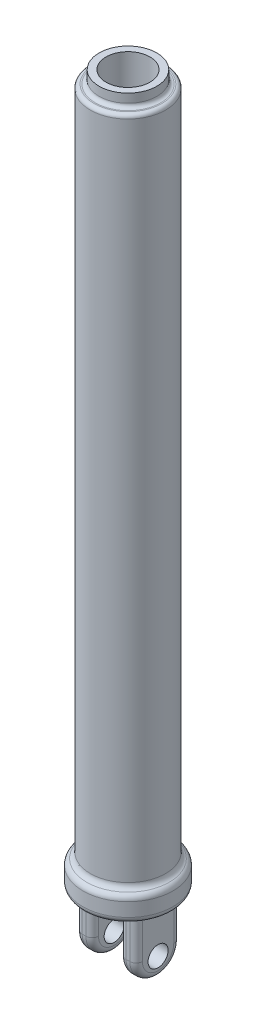
from build123d import *

# Parameters (mm, degrees)
SKETCH2_W           = 13
SKETCH2_H           = 35
BOSS_EXTRUDE1_DEPTH = 50
SKETCH3_R           = 8
CUT_EXTRUDE1_DEPTH  = 570.286608073
FILLET1_R           = 5


with BuildPart() as part:
    # Sketch1 → Revolve1 (revolve)
    with BuildSketch(Plane.XY):
        with BuildLine():
            Line((-30, 552), (-30, 24.977358367))
            ThreePointArc((-30, 24.977358367), (-30.790465371, 22.279244542), (-32.911927285, 20.434236936))
            ThreePointArc((-32.911927285, 20.434236936), (-35.033389198, 18.58922933), (-35.823854569, 15.891115505))
            Line((-35.823854569, 15.891115505), (-35.823854569, 5))
            ThreePointArc((-35.823854569, 5), (-34.359388475, 1.464466094), (-30.823854569, 0))
            Line((-30.823854569, 0), (0, 0))
            Line((0, 0), (0, 40))
            Line((0, 40), (-17.5, 40))
            Line((-17.5, 40), (-17.5, 565))
            Line((-17.5, 565), (-23, 565))
            Line((-23, 565), (-23, 558))
            ThreePointArc((-23, 558), (-23.878679656, 555.878679656), (-26, 555))
            Line((-26, 555), (-27, 555))
            ThreePointArc((-27, 555), (-29.121320344, 554.121320344), (-30, 552))
        make_face()
    revolve(axis=Axis((0, 40, 0), (0, -1, 0)))

    # Sketch2 → Boss-Extrude1 (add)
    with BuildSketch(Plane.XZ):
        with Locations((17.5, 0)):
            Rectangle(SKETCH2_W, SKETCH2_H)
        with Locations((-17.5, 0)):
            Rectangle(SKETCH2_W, SKETCH2_H)
    extrude(amount=BOSS_EXTRUDE1_DEPTH)

    # Sketch3 → Cut-Extrude1 (cut, through all)
    with BuildSketch(Plane(origin=(24, 0, 0), x_dir=(0, 0, -1), z_dir=(1, 0, 0))):
        with BuildLine():
            ThreePointArc((0, -50), (-12.374368671, -44.874368671), (-17.5, -32.5))
            Line((-17.5, -32.5), (-17.5, -50))
            Line((-17.5, -50), (0, -50))
        make_face()
        with BuildLine():
            ThreePointArc((17.5, -32.5), (12.374368671, -44.874368671), (0, -50))
            Line((0, -50), (17.5, -50))
            Line((17.5, -50), (17.5, -32.5))
        make_face()
        with Locations((0, -35)):
            Circle(SKETCH3_R)
    extrude(amount=-CUT_EXTRUDE1_DEPTH, mode=Mode.SUBTRACT)

    # Fillet1
    fillet1_edges = [part.edges().sort_by_distance(p)[0] for p in [
        (24, -16.25, 17.5),
        (24, -16.25, -17.5),
        (11, -16.25, 17.5),
        (11, -16.25, -17.5),
        (-11, -16.25, -17.5),
        (-11, -16.25, 17.5),
        (-24, -16.25, 17.5),
        (-24, -16.25, -17.5),
        (24, -50, 0),
        (11, -50, 0),
        (-11, -50, 0),
        (-24, -50, 0),
    ]]
    fillet(fillet1_edges, radius=FILLET1_R)


solid = part.part
